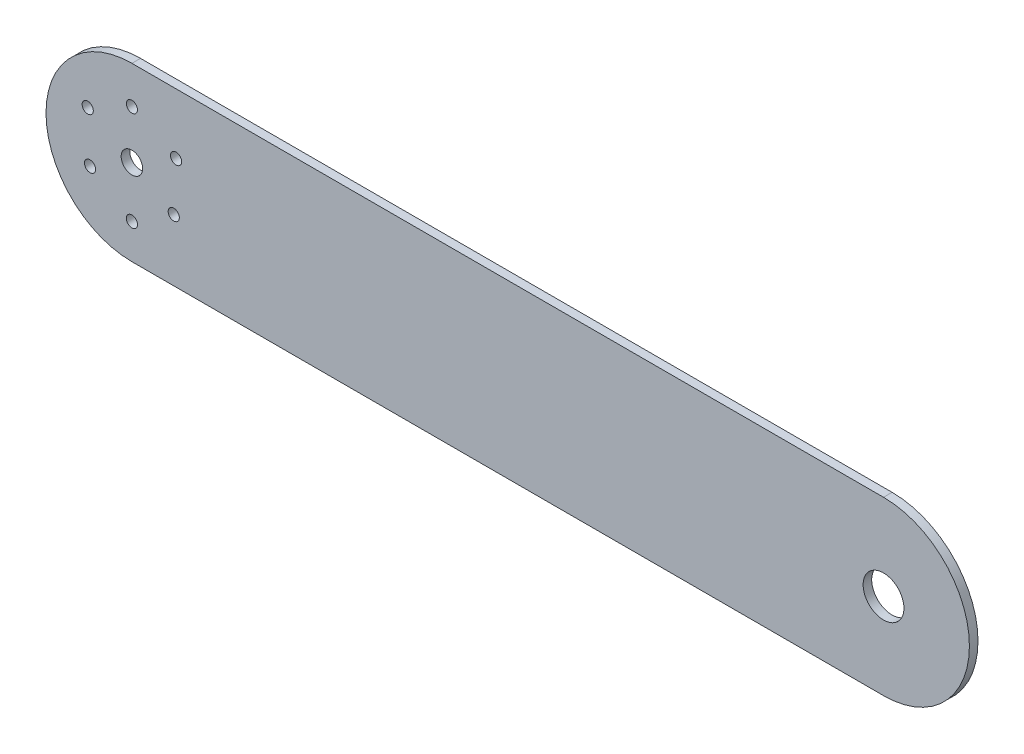
from build123d import *

# Parameters (mm, degrees)
SKETCH_1_R      = 2.6
SKETCH_1_R_2    = 5
SKETCH_1_R_3    = 9.5
EXTRUDE_1_DEPTH = 4


with BuildPart() as part:
    # 草图1 → 凸台-拉伸1 (new body)
    with BuildSketch(Plane.XY):
        with BuildLine():
            Line((-1.457142857, 39.854285714), (348.542857143, 39.854285714))
            ThreePointArc((348.542857143, 39.854285714), (388.542857143, -0.145714286), (348.542857143, -40.145714286))
            Line((348.542857143, -40.145714286), (-1.457142857, -40.145714286))
            ThreePointArc((-1.457142857, -40.145714286), (-41.457142857, -0.145714286), (-1.457142857, 39.854285714))
        make_face()
        with Locations((-1.457142857, -23.895714286)):
            Circle(SKETCH_1_R, mode=Mode.SUBTRACT)
        with Locations((18.028428728, -11.395714286)):
            Circle(SKETCH_1_R, mode=Mode.SUBTRACT)
        with Locations((-1.457142857, -0.145714286)):
            Circle(SKETCH_1_R_2, mode=Mode.SUBTRACT)
        with Locations((-22.025246197, 11.729285714)):
            Circle(SKETCH_1_R, mode=Mode.SUBTRACT)
        with Locations((19.110960483, 11.729285714)):
            Circle(SKETCH_1_R, mode=Mode.SUBTRACT)
        with Locations((-20.942714442, -11.395714286)):
            Circle(SKETCH_1_R, mode=Mode.SUBTRACT)
        with Locations((-1.457142857, 22.354285714)):
            Circle(SKETCH_1_R, mode=Mode.SUBTRACT)
        with Locations((348.542857143, -0.145714286)):
            Circle(SKETCH_1_R_3, mode=Mode.SUBTRACT)
    extrude(amount=EXTRUDE_1_DEPTH)


solid = part.part
